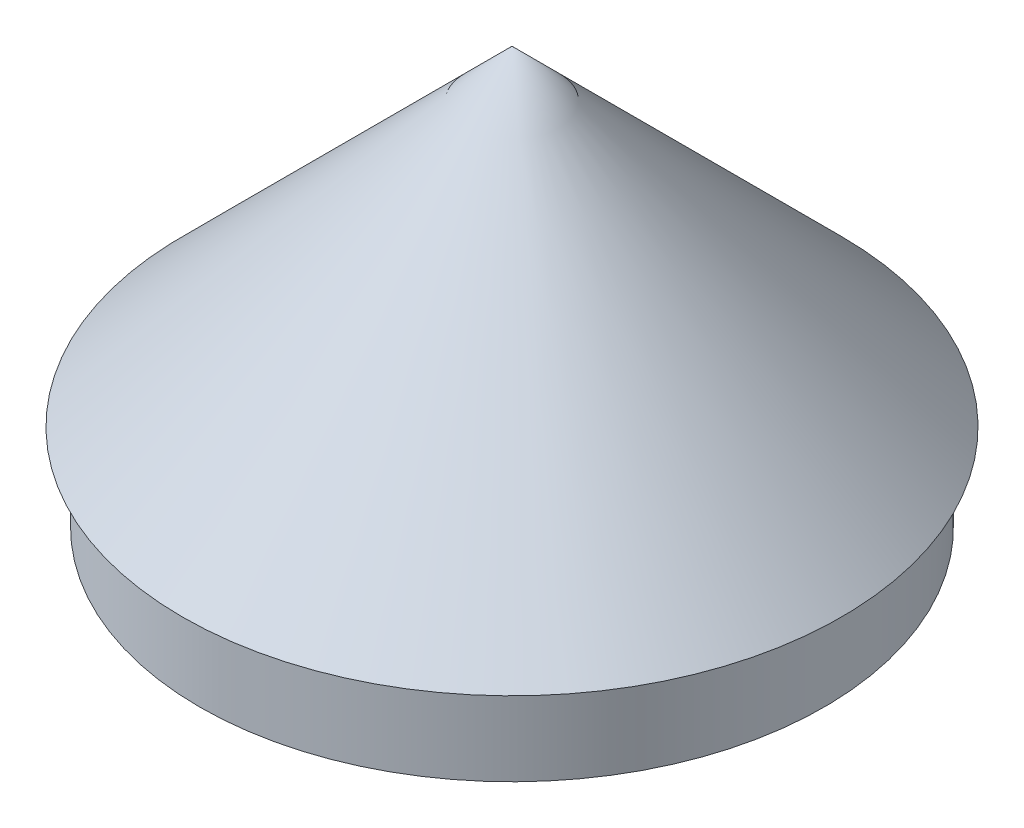
from build123d import *

# Parameters (mm, degrees)
SKETCH1_R           = 18
BOSS_EXTRUDE1_DEPTH = 5


# Read off the part's stored shape, not the designer's step: Boss-Extrude2
with BuildPart() as part:
    # Sketch1 → Boss-Extrude1 (new body)
    with BuildSketch(Plane(origin=(0, 0, 0), x_dir=(1, 0, 0), z_dir=(0, 1, 0))):
        with Locations(Location((0, 0, 0), (0, 0, 270))):
            Circle(SKETCH1_R)
    extrude(amount=BOSS_EXTRUDE1_DEPTH)

    # Boss-Extrude2 outline → Boss-Extrude2 (revolve)
    with BuildSketch(Plane.XY):
        Polygon((19, 5), (0, 24), (0, 5), align=None)
    revolve(axis=Axis((0, 0, 0), (0, 1, 0)))


solid = part.part
